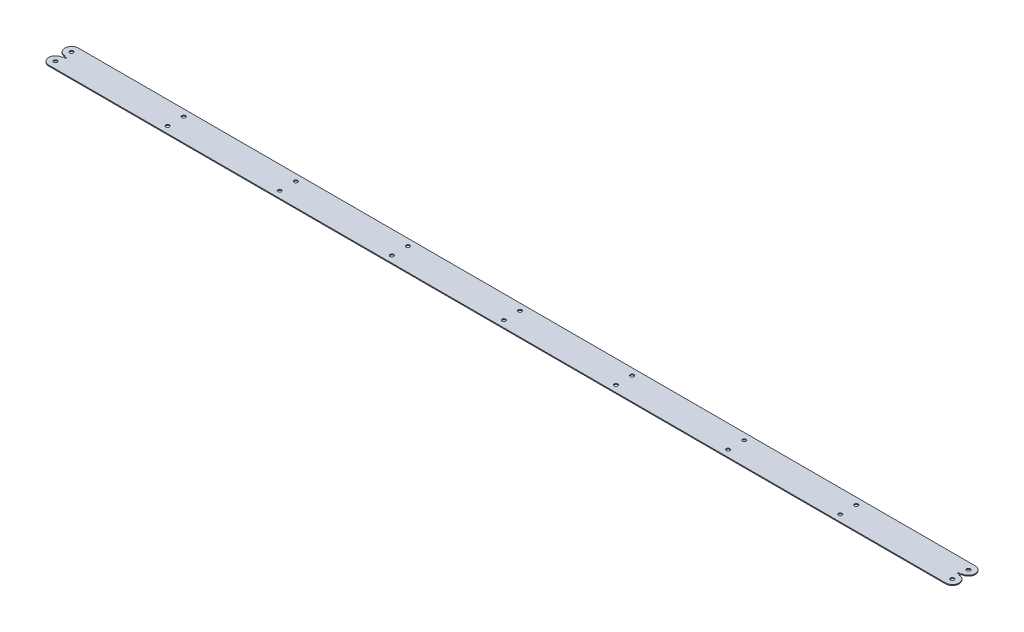
from build123d import *

# Parameters (mm, degrees)
SKETCH1_R           = 2
BOSS_EXTRUDE1_DEPTH = 1


with BuildPart() as part:
    # Sketch1 → Boss-Extrude1 (new body)
    with BuildSketch(Plane(origin=(0, 0, 0), x_dir=(1, 0, 0), z_dir=(0, 1, 0))):
        with BuildLine():
            Line((-500, -7.5), (500, -7.5))
            ThreePointArc((500, -7.5), (507.5, 0), (500, 7.5))
            Line((500, 7.5), (500, 8.5))
            Line((500, 8.5), (497, 8.5))
            Line((497, 8.5), (497, 9.5))
            Line((497, 9.5), (500, 9.5))
            Line((500, 9.5), (500, 10.5))
            ThreePointArc((500, 10.5), (507.5, 18), (500, 25.5))
            Line((500, 25.5), (-500, 25.5))
            ThreePointArc((-500, 25.5), (-507.5, 18), (-500, 10.5))
            Line((-500, 10.5), (-500, 9.5))
            Line((-500, 9.5), (-497, 9.5))
            Line((-497, 9.5), (-497, 8.5))
            Line((-497, 8.5), (-500, 8.5))
            Line((-500, 8.5), (-500, 7.5))
            ThreePointArc((-500, 7.5), (-504.937104415, 5.645794895), (-507.433034374, 1))
            Line((-507.433034374, 1), (-507.5, 1))
            Line((-507.5, 1), (-507.5, -1))
            Line((-507.5, -1), (-507.433034374, -1))
            ThreePointArc((-507.433034374, -1), (-504.937104415, -5.645794895), (-500, -7.5))
        make_face()
        Circle(SKETCH1_R, mode=Mode.SUBTRACT)
        with Locations((125, 0)):
            Circle(SKETCH1_R, mode=Mode.SUBTRACT)
        with Locations((250, 0)):
            Circle(SKETCH1_R, mode=Mode.SUBTRACT)
        with Locations((375, 0)):
            Circle(SKETCH1_R, mode=Mode.SUBTRACT)
        with Locations((500, 0)):
            Circle(SKETCH1_R, mode=Mode.SUBTRACT)
        with Locations((-125, 0)):
            Circle(SKETCH1_R, mode=Mode.SUBTRACT)
        with Locations((-250, 0)):
            Circle(SKETCH1_R, mode=Mode.SUBTRACT)
        with Locations((-375, 0)):
            Circle(SKETCH1_R, mode=Mode.SUBTRACT)
        with Locations((-500, 0)):
            Circle(SKETCH1_R, mode=Mode.SUBTRACT)
        with Locations((0, 18)):
            Circle(SKETCH1_R, mode=Mode.SUBTRACT)
        with Locations((125, 18)):
            Circle(SKETCH1_R, mode=Mode.SUBTRACT)
        with Locations((250, 18)):
            Circle(SKETCH1_R, mode=Mode.SUBTRACT)
        with Locations((375, 18)):
            Circle(SKETCH1_R, mode=Mode.SUBTRACT)
        with Locations((500, 18)):
            Circle(SKETCH1_R, mode=Mode.SUBTRACT)
        with Locations((-125, 18)):
            Circle(SKETCH1_R, mode=Mode.SUBTRACT)
        with Locations((-250, 18)):
            Circle(SKETCH1_R, mode=Mode.SUBTRACT)
        with Locations((-375, 18)):
            Circle(SKETCH1_R, mode=Mode.SUBTRACT)
        with Locations((-500, 18)):
            Circle(SKETCH1_R, mode=Mode.SUBTRACT)
    extrude(amount=BOSS_EXTRUDE1_DEPTH)


solid = part.part
